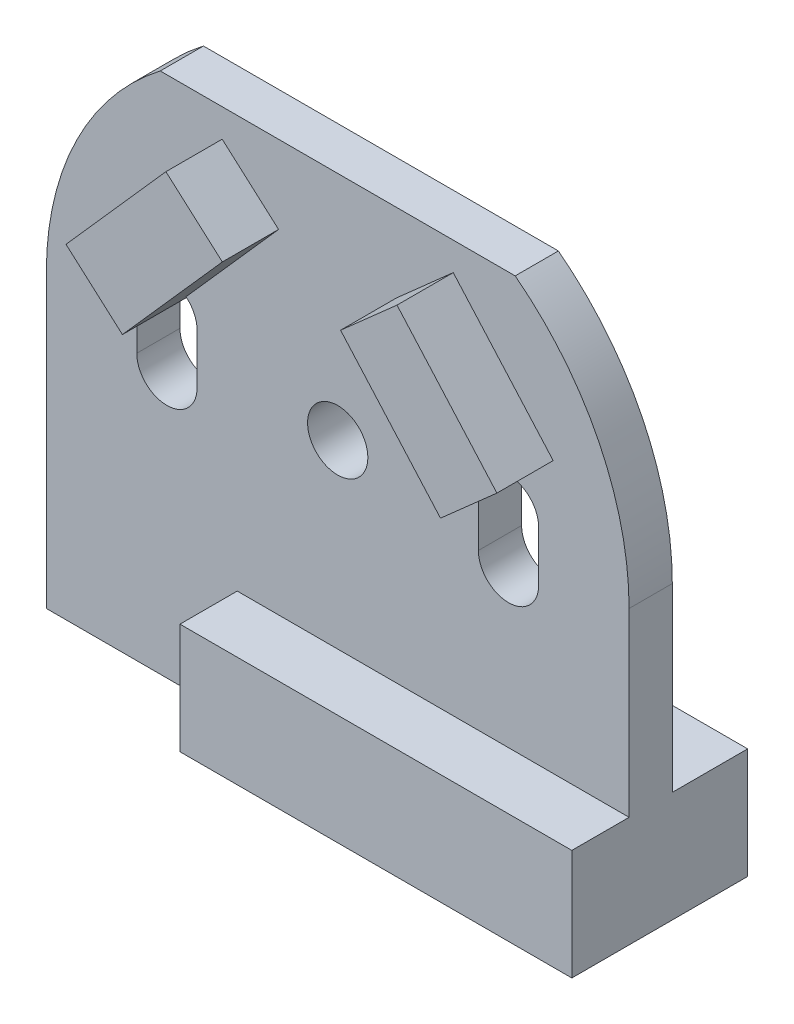
from build123d import *

# Parameters (mm, degrees)
SKETCH1_R                = 0.6
BOSS_EXTRUDE1_DEPTH      = 0.86
BOSS_EXTRUDE2_DEPTH      = 1.98
BOSS_EXTRUDE3_DEPTH      = 2
BOSS_EXTRUDE3_DEPTH_BACK = 1.5
SKETCH1_4_W              = 7.8
SKETCH1_4_H              = 2.2


with BuildPart() as part:
    # Sketch1 → Boss-Extrude1 (new body)
    with BuildSketch(Plane.XY):
        with BuildLine():
            Line((-5.8, 0), (-5.8, -5.8))
            Line((-5.8, -5.8), (5.8, -5.8))
            Line((5.8, -5.8), (5.8, 0))
            ThreePointArc((5.8, 0), (5.202388164, 2.564206972), (3.532704347, 4.6))
            Line((3.532704347, 4.6), (-3.532704347, 4.6))
            ThreePointArc((-3.532704347, 4.6), (-5.202388164, 2.564206972), (-5.8, 0))
        make_face()
        with BuildLine():
            Line((4, 0.5), (4, -0.5))
            ThreePointArc((4, -0.5), (3.4, -1.1), (2.8, -0.5))
            Line((2.8, -0.5), (2.8, 0.5))
            ThreePointArc((2.8, 0.5), (3.4, 1.1), (4, 0.5))
        make_face(mode=Mode.SUBTRACT)
        Circle(SKETCH1_R, mode=Mode.SUBTRACT)
        with BuildLine():
            Line((-2.8, 0.5), (-2.8, -0.5))
            ThreePointArc((-2.8, -0.5), (-3.4, -1.1), (-4, -0.5))
            Line((-4, -0.5), (-4, 0.5))
            ThreePointArc((-4, 0.5), (-3.4, 1.1), (-2.8, 0.5))
        make_face(mode=Mode.SUBTRACT)
    extrude(amount=BOSS_EXTRUDE1_DEPTH)

    # Sketch1<3> → Boss-Extrude2 (add)
    with BuildSketch(Plane.XY):
        Polygon((-4.288680522, 1.793660888), (-3.165609978, 0.799320628), (-1.176929457, 3.045461714), (-2.3, 4.039801975), align=None)
        Polygon((1.176929457, 3.045461714), (3.165609978, 0.799320628), (4.288680522, 1.793660888), (2.3, 4.039801975), align=None)
    extrude(amount=BOSS_EXTRUDE2_DEPTH)

    # Sketch1<4> → Boss-Extrude3 (add, two sides: drawn at the far end of the back side and taken through both)
    with BuildSketch(Plane.XY.offset(-BOSS_EXTRUDE3_DEPTH_BACK)):
        with Locations((1.9, -4.7)):
            Rectangle(SKETCH1_4_W, SKETCH1_4_H)
    extrude(amount=BOSS_EXTRUDE3_DEPTH + BOSS_EXTRUDE3_DEPTH_BACK)


solid = part.part
